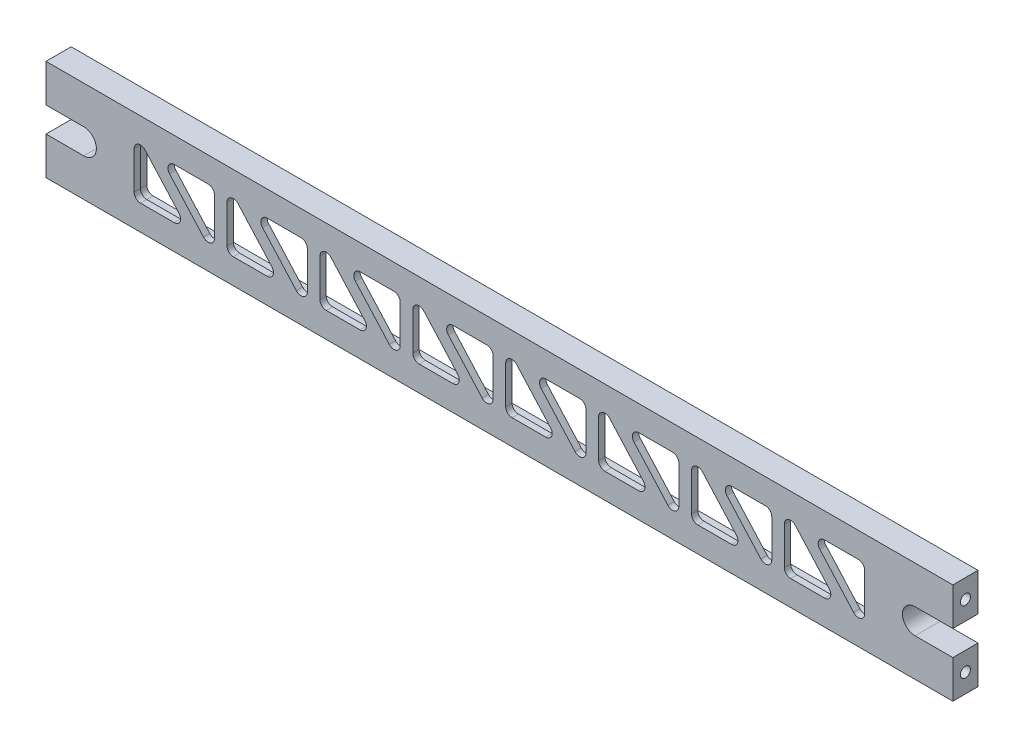
from build123d import *

# Parameters (mm, degrees)
SKETCH1_W                             = 12.7
SKETCH1_H                             = 50.8
BOSS_EXTRUDE1_DEPTH                   = 228.6
F_1_4_20_TAPPED_HOLE1_D               = 5.1054
F_1_4_20_TAPPED_HOLE1_DEPTH           = 29.21
F_1_4_20_TAPPED_HOLE1_TIP             = 1.533816902
F_1_4_20_TAPPED_HOLE1_ON_FACE_2_D     = 5.1054
F_1_4_20_TAPPED_HOLE1_ON_FACE_2_DEPTH = 29.21
F_1_4_20_TAPPED_HOLE1_ON_FACE_2_TIP   = 1.533816902
CUT_EXTRUDE1_DEPTH                    = 9.525
CUT_EXTRUDE2_DEPTH                    = 235.370061281
CUT_EXTRUDE3_DEPTH                    = 235.52055347


with BuildPart() as part:
    # Sketch1 → Boss-Extrude1 (new, symmetric)
    with BuildSketch(Plane(origin=(0, 0, 0), x_dir=(0, 0, -1), z_dir=(1, 0, 0))):
        with Locations((6.35, 25.4)):
            Rectangle(SKETCH1_W, SKETCH1_H)
    extrude(amount=BOSS_EXTRUDE1_DEPTH, both=True)

    # 1/4-20 Tapped Hole1
    with Locations(Plane(origin=(228.6, 41.275, -6.35), x_dir=(0, 0, 1), z_dir=(1, 0, 0))):
        with Locations((0, 0), (0, 31.75)):
            Hole(F_1_4_20_TAPPED_HOLE1_D / 2, depth=F_1_4_20_TAPPED_HOLE1_DEPTH)
            with Locations((0, 0, -(F_1_4_20_TAPPED_HOLE1_DEPTH + F_1_4_20_TAPPED_HOLE1_TIP / 2))):  # 118° drill point
                Cone(0, F_1_4_20_TAPPED_HOLE1_D / 2, F_1_4_20_TAPPED_HOLE1_TIP, mode=Mode.SUBTRACT)

    # 1/4-20 Tapped Hole1 on face 2
    with Locations(Plane(origin=(-228.6, 9.525, -6.35), x_dir=(0, 0, -1), z_dir=(-1, 0, 0))):
        with Locations((0, 0), (0, -31.75)):
            Hole(F_1_4_20_TAPPED_HOLE1_ON_FACE_2_D / 2, depth=F_1_4_20_TAPPED_HOLE1_ON_FACE_2_DEPTH)
            with Locations((0, 0, -(F_1_4_20_TAPPED_HOLE1_ON_FACE_2_DEPTH + F_1_4_20_TAPPED_HOLE1_ON_FACE_2_TIP / 2))):  # 118° drill point
                Cone(0, F_1_4_20_TAPPED_HOLE1_ON_FACE_2_D / 2, F_1_4_20_TAPPED_HOLE1_ON_FACE_2_TIP, mode=Mode.SUBTRACT)

    # Sketch4 → Cut-Extrude1 (cut)
    with BuildSketch(Plane(origin=(0, 0, -12.7), x_dir=(-1, 0, 0), z_dir=(0, 0, -1))):
        with BuildLine():
            Line((187.325, 44.45), (-187.325, 44.45))
            ThreePointArc((-187.325, 44.45), (-189.57006403, 43.52006403), (-190.5, 41.275))
            Line((-190.5, 41.275), (-190.5, 9.525))
            ThreePointArc((-190.5, 9.525), (-189.57006403, 7.27993597), (-187.325, 6.35))
            Line((-187.325, 6.35), (187.325, 6.35))
            ThreePointArc((187.325, 6.35), (189.57006403, 7.27993597), (190.5, 9.525))
            Line((190.5, 9.525), (190.5, 41.275))
            ThreePointArc((190.5, 41.275), (189.57006403, 43.52006403), (187.325, 44.45))
        make_face()
    extrude(amount=-CUT_EXTRUDE1_DEPTH, mode=Mode.SUBTRACT)

    # Sketch5 → Cut-Extrude2 (cut, through all)
    with BuildSketch(Plane(origin=(0, 0, -3.175), x_dir=(-1, 0, 0), z_dir=(0, 0, -1))):
        with BuildLine():
            Line((-184.15, 34.925), (-184.15, 15.875))
            ThreePointArc((-184.15, 15.875), (-182.109512204, 12.909615192), (-178.610782954, 13.755777793))
            Line((-178.610782954, 13.755777793), (-161.534862149, 32.805777793))
            ThreePointArc((-161.534862149, 32.805777793), (-161.000014215, 36.219622434), (-163.899079195, 38.1))
            Line((-163.899079195, 38.1), (-180.975, 38.1))
            ThreePointArc((-180.975, 38.1), (-183.22006403, 37.17006403), (-184.15, 34.925))
        make_face()
        with BuildLine():
            Line((-166.283887851, 17.994222207), (-149.207967046, 37.044222207))
            ThreePointArc((-149.207967046, 37.044222207), (-145.709237796, 37.890384808), (-143.66875, 34.925))
            Line((-143.66875, 34.925), (-143.66875, 15.875))
            ThreePointArc((-143.66875, 15.875), (-144.59868597, 13.62993597), (-146.84375, 12.7))
            Line((-146.84375, 12.7), (-163.919670805, 12.7))
            ThreePointArc((-163.919670805, 12.7), (-166.818735785, 14.580377566), (-166.283887851, 17.994222207))
        make_face()
        with BuildLine():
            Line((-137.31875, 34.925), (-137.31875, 15.875))
            ThreePointArc((-137.31875, 15.875), (-135.278262204, 12.909615192), (-131.779532954, 13.755777793))
            Line((-131.779532954, 13.755777793), (-114.703612149, 32.805777793))
            ThreePointArc((-114.703612149, 32.805777793), (-114.168764215, 36.219622434), (-117.067829195, 38.1))
            Line((-117.067829195, 38.1), (-134.14375, 38.1))
            ThreePointArc((-134.14375, 38.1), (-136.38881403, 37.17006403), (-137.31875, 34.925))
        make_face()
        with BuildLine():
            Line((-119.452637851, 17.994222207), (-102.376717046, 37.044222207))
            ThreePointArc((-102.376717046, 37.044222207), (-98.877987796, 37.890384808), (-96.8375, 34.925))
            Line((-96.8375, 34.925), (-96.8375, 15.875))
            ThreePointArc((-96.8375, 15.875), (-97.76743597, 13.62993597), (-100.0125, 12.7))
            Line((-100.0125, 12.7), (-117.088420805, 12.7))
            ThreePointArc((-117.088420805, 12.7), (-119.987485785, 14.580377566), (-119.452637851, 17.994222207))
        make_face()
        with BuildLine():
            Line((-90.4875, 34.925), (-90.4875, 15.875))
            ThreePointArc((-90.4875, 15.875), (-88.447012204, 12.909615192), (-84.948282954, 13.755777793))
            Line((-84.948282954, 13.755777793), (-67.872362149, 32.805777793))
            ThreePointArc((-67.872362149, 32.805777793), (-67.337514215, 36.219622434), (-70.236579195, 38.1))
            Line((-70.236579195, 38.1), (-87.3125, 38.1))
            ThreePointArc((-87.3125, 38.1), (-89.55756403, 37.17006403), (-90.4875, 34.925))
        make_face()
        with BuildLine():
            Line((-72.621387851, 17.994222207), (-55.545467046, 37.044222207))
            ThreePointArc((-55.545467046, 37.044222207), (-52.046737796, 37.890384808), (-50.00625, 34.925))
            Line((-50.00625, 34.925), (-50.00625, 15.875))
            ThreePointArc((-50.00625, 15.875), (-50.93618597, 13.62993597), (-53.18125, 12.7))
            Line((-53.18125, 12.7), (-70.257170805, 12.7))
            ThreePointArc((-70.257170805, 12.7), (-73.156235785, 14.580377566), (-72.621387851, 17.994222207))
        make_face()
        with BuildLine():
            Line((-43.65625, 34.925), (-43.65625, 15.875))
            ThreePointArc((-43.65625, 15.875), (-41.615762204, 12.909615192), (-38.117032954, 13.755777793))
            Line((-38.117032954, 13.755777793), (-21.041112149, 32.805777793))
            ThreePointArc((-21.041112149, 32.805777793), (-20.506264215, 36.219622434), (-23.405329195, 38.1))
            Line((-23.405329195, 38.1), (-40.48125, 38.1))
            ThreePointArc((-40.48125, 38.1), (-42.72631403, 37.17006403), (-43.65625, 34.925))
        make_face()
        with BuildLine():
            Line((-25.790137851, 17.994222207), (-8.714217046, 37.044222207))
            ThreePointArc((-8.714217046, 37.044222207), (-5.215487796, 37.890384808), (-3.175, 34.925))
            Line((-3.175, 34.925), (-3.175, 15.875))
            ThreePointArc((-3.175, 15.875), (-4.10493597, 13.62993597), (-6.35, 12.7))
            Line((-6.35, 12.7), (-23.425920805, 12.7))
            ThreePointArc((-23.425920805, 12.7), (-26.324985785, 14.580377566), (-25.790137851, 17.994222207))
        make_face()
        with BuildLine():
            Line((3.175, 34.925), (3.175, 15.875))
            ThreePointArc((3.175, 15.875), (5.215487796, 12.909615192), (8.714217046, 13.755777793))
            Line((8.714217046, 13.755777793), (25.790137851, 32.805777793))
            ThreePointArc((25.790137851, 32.805777793), (26.324985785, 36.219622434), (23.425920805, 38.1))
            Line((23.425920805, 38.1), (6.35, 38.1))
            ThreePointArc((6.35, 38.1), (4.10493597, 37.17006403), (3.175, 34.925))
        make_face()
        with BuildLine():
            Line((21.041112149, 17.994222207), (38.117032954, 37.044222207))
            ThreePointArc((38.117032954, 37.044222207), (41.615762204, 37.890384808), (43.65625, 34.925))
            Line((43.65625, 34.925), (43.65625, 15.875))
            ThreePointArc((43.65625, 15.875), (42.72631403, 13.62993597), (40.48125, 12.7))
            Line((40.48125, 12.7), (23.405329195, 12.7))
            ThreePointArc((23.405329195, 12.7), (20.506264215, 14.580377566), (21.041112149, 17.994222207))
        make_face()
        with BuildLine():
            Line((50.00625, 34.925), (50.00625, 15.875))
            ThreePointArc((50.00625, 15.875), (52.046737796, 12.909615192), (55.545467046, 13.755777793))
            Line((55.545467046, 13.755777793), (72.621387851, 32.805777793))
            ThreePointArc((72.621387851, 32.805777793), (73.156235785, 36.219622434), (70.257170805, 38.1))
            Line((70.257170805, 38.1), (53.18125, 38.1))
            ThreePointArc((53.18125, 38.1), (50.93618597, 37.17006403), (50.00625, 34.925))
        make_face()
        with BuildLine():
            Line((67.872362149, 17.994222207), (84.948282954, 37.044222207))
            ThreePointArc((84.948282954, 37.044222207), (88.447012204, 37.890384808), (90.4875, 34.925))
            Line((90.4875, 34.925), (90.4875, 15.875))
            ThreePointArc((90.4875, 15.875), (89.55756403, 13.62993597), (87.3125, 12.7))
            Line((87.3125, 12.7), (70.236579195, 12.7))
            ThreePointArc((70.236579195, 12.7), (67.337514215, 14.580377566), (67.872362149, 17.994222207))
        make_face()
        with BuildLine():
            Line((96.8375, 34.925), (96.8375, 15.875))
            ThreePointArc((96.8375, 15.875), (98.877987796, 12.909615192), (102.376717046, 13.755777793))
            Line((102.376717046, 13.755777793), (119.452637851, 32.805777793))
            ThreePointArc((119.452637851, 32.805777793), (119.987485785, 36.219622434), (117.088420805, 38.1))
            Line((117.088420805, 38.1), (100.0125, 38.1))
            ThreePointArc((100.0125, 38.1), (97.76743597, 37.17006403), (96.8375, 34.925))
        make_face()
        with BuildLine():
            Line((114.703612149, 17.994222207), (131.779532954, 37.044222207))
            ThreePointArc((131.779532954, 37.044222207), (135.278262204, 37.890384808), (137.31875, 34.925))
            Line((137.31875, 34.925), (137.31875, 15.875))
            ThreePointArc((137.31875, 15.875), (136.38881403, 13.62993597), (134.14375, 12.7))
            Line((134.14375, 12.7), (117.067829195, 12.7))
            ThreePointArc((117.067829195, 12.7), (114.168764215, 14.580377566), (114.703612149, 17.994222207))
        make_face()
        with BuildLine():
            Line((143.66875, 34.925), (143.66875, 15.875))
            ThreePointArc((143.66875, 15.875), (145.709237796, 12.909615192), (149.207967046, 13.755777793))
            Line((149.207967046, 13.755777793), (166.283887851, 32.805777793))
            ThreePointArc((166.283887851, 32.805777793), (166.818735785, 36.219622434), (163.919670805, 38.1))
            Line((163.919670805, 38.1), (146.84375, 38.1))
            ThreePointArc((146.84375, 38.1), (144.59868597, 37.17006403), (143.66875, 34.925))
        make_face()
        with BuildLine():
            Line((161.534862149, 17.994222207), (178.610782954, 37.044222207))
            ThreePointArc((178.610782954, 37.044222207), (182.109512204, 37.890384808), (184.15, 34.925))
            Line((184.15, 34.925), (184.15, 15.875))
            ThreePointArc((184.15, 15.875), (183.22006403, 13.62993597), (180.975, 12.7))
            Line((180.975, 12.7), (163.899079195, 12.7))
            ThreePointArc((163.899079195, 12.7), (161.000014215, 14.580377566), (161.534862149, 17.994222207))
        make_face()
    extrude(amount=-CUT_EXTRUDE2_DEPTH, mode=Mode.SUBTRACT)

    # Sketch6 → Cut-Extrude3 (cut, through all)
    with BuildSketch(Plane.XY):
        with BuildLine():
            Line((-209.55, 31.75), (-228.6, 31.75))
            Line((-228.6, 31.75), (-228.6, 19.05))
            Line((-228.6, 19.05), (-209.55, 19.05))
            ThreePointArc((-209.55, 19.05), (-203.2, 25.4), (-209.55, 31.75))
        make_face()
        with BuildLine():
            Line((228.6, 19.05), (209.55, 19.05))
            ThreePointArc((209.55, 19.05), (203.2, 25.4), (209.55, 31.75))
            Line((209.55, 31.75), (228.6, 31.75))
            Line((228.6, 31.75), (228.6, 19.05))
        make_face()
    extrude(amount=-CUT_EXTRUDE3_DEPTH, mode=Mode.SUBTRACT)


solid = part.part
